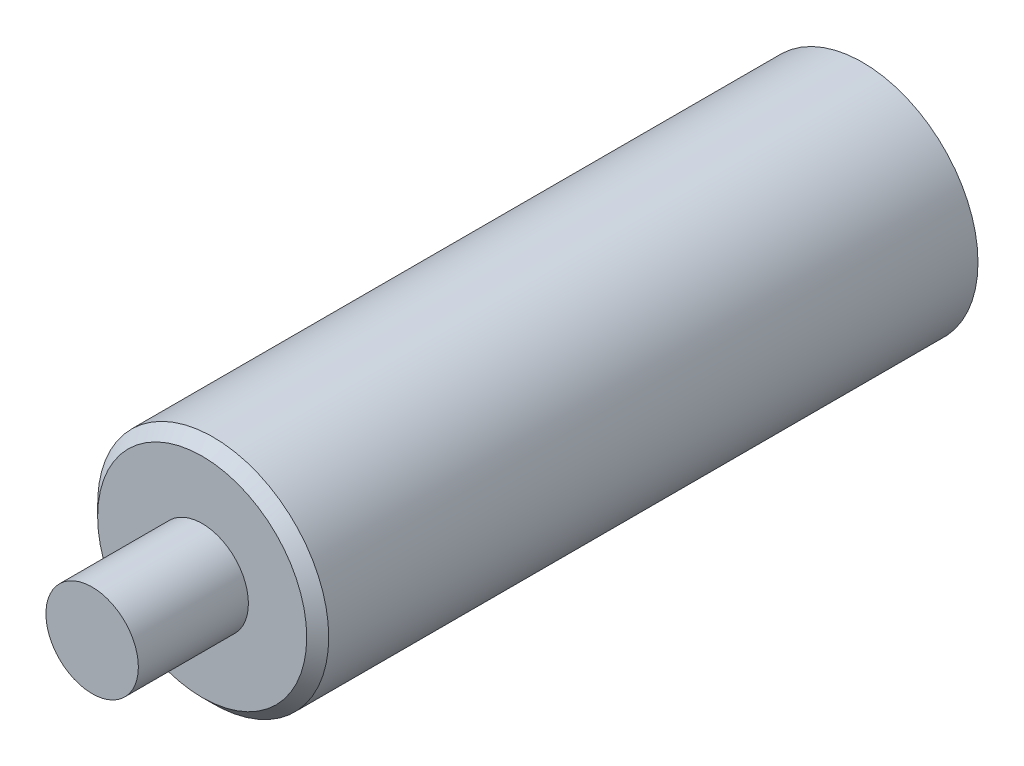
from build123d import *

# Parameters (mm, degrees)
ESQUISSE1_R                  = 5.25
BOSS_EXTRU_1_DEPTH           = 30
CHANFREIN1_SIZE              = 0.5
ENL_V_MAT_EXTRU_1_DEPTH      = 31.905096667
ENL_V_MAT_EXTRU_1_DEPTH_BACK = 15
ESQUISSE2_R                  = 1.75
ESQUISSE4_R                  = 2.1
BOSS_EXTRU_2_DEPTH           = 5


with BuildPart() as part:
    # Esquisse1 → Boss.-Extru.1 (new body)
    with BuildSketch(Plane.XY):
        Circle(ESQUISSE1_R)
    extrude(amount=BOSS_EXTRU_1_DEPTH)

    # Chanfrein1
    chanfrein1_edges = [part.edges().sort_by_distance(p)[0] for p in [
        (-5.25, 0, 30),
    ]]
    chamfer(chanfrein1_edges, length=CHANFREIN1_SIZE)

    # Esquisse2 → Enlèv. mat.-Extru.1 (cut, two sides: drawn at the far end of the back side and taken through both)
    with BuildSketch(Plane(origin=(0, 0, 0), x_dir=(-1, 0, 0), z_dir=(0, 0, -1)).offset(-ENL_V_MAT_EXTRU_1_DEPTH_BACK)):
        Circle(ESQUISSE2_R)
    extrude(amount=ENL_V_MAT_EXTRU_1_DEPTH + ENL_V_MAT_EXTRU_1_DEPTH_BACK, mode=Mode.SUBTRACT)

    # Esquisse4 → Boss.-Extru.2 (add)
    with BuildSketch(Plane.XY.offset(30)):
        Circle(ESQUISSE4_R)
    extrude(amount=BOSS_EXTRU_2_DEPTH)


solid = part.part
